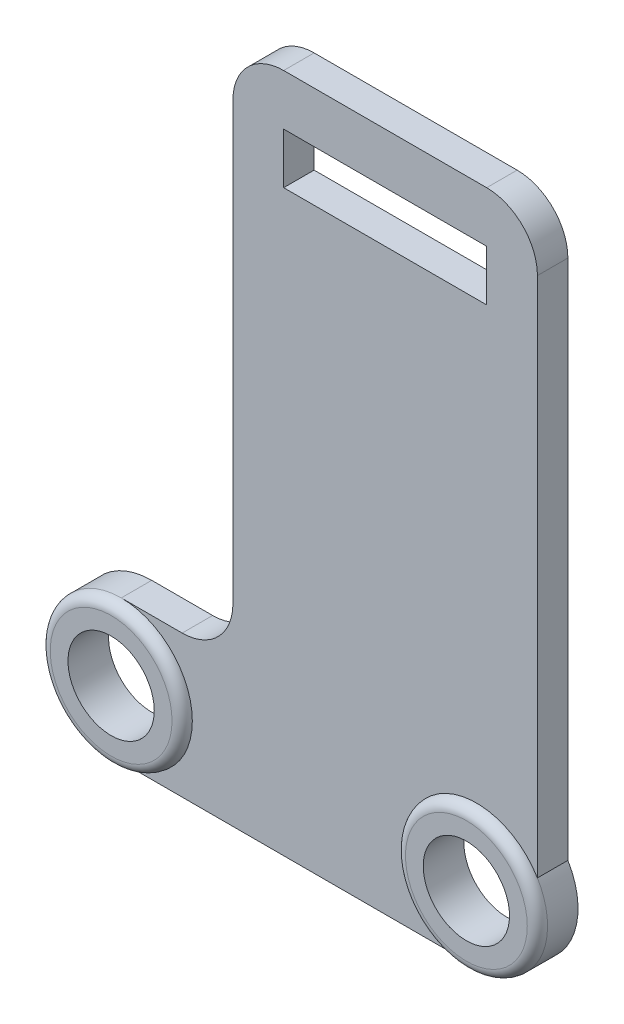
from build123d import *

# Parameters (mm, degrees)
SKETCH1_R           = 4.25
SKETCH1_W           = 20
SKETCH1_H           = 5
BOSS_EXTRUDE1_DEPTH = 3
SKETCH2_R           = 7
SKETCH2_R_2         = 4.25
BOSS_EXTRUDE2_DEPTH = 1
FILLET1_R           = 1


with BuildPart() as part:
    # Sketch1 → Boss-Extrude1 (new body)
    with BuildSketch(Plane.XY):
        with BuildLine():
            Line((9, -33.5), (-26, -33.5))
            ThreePointArc((-26, -33.5), (-33, -26.5), (-26, -19.5))
            Line((-26, -19.5), (-20, -19.5))
            ThreePointArc((-20, -19.5), (-16.464466094, -18.035533906), (-15, -14.5))
            Line((-15, -14.5), (-15, 28.5))
            ThreePointArc((-15, 28.5), (-13.535533906, 32.035533906), (-10, 33.5))
            Line((-10, 33.5), (10, 33.5))
            ThreePointArc((10, 33.5), (13.535533906, 32.035533906), (15, 28.5))
            Line((15, 28.5), (15, -22.894448725))
            ThreePointArc((15, -22.894448725), (15.092571663, -29.946820352), (9, -33.5))
        make_face()
        with Locations((9, -26.5)):
            Circle(SKETCH1_R, mode=Mode.SUBTRACT)
        with Locations((-26, -26.5)):
            Circle(SKETCH1_R, mode=Mode.SUBTRACT)
        with Locations((0, 26)):
            Rectangle(SKETCH1_W, SKETCH1_H, mode=Mode.SUBTRACT)
    extrude(amount=BOSS_EXTRUDE1_DEPTH)

    # Sketch2 → Boss-Extrude2 (add)
    # profile 1 of 2: a face of its own
    with BuildSketch(Plane.XY.offset(3)):
        with Locations(Location((-26, -26.5, 0), (0, 0, 270))):
            Circle(SKETCH2_R)
        with Locations((-26, -26.5)):
            Circle(SKETCH2_R_2, mode=Mode.SUBTRACT)
    # profile 2 of 2: a face of its own
    with BuildSketch(Plane.XY.offset(3)):
        with Locations(Location((9, -26.5, 0), (0, 0, 270))):
            Circle(SKETCH2_R)
        with Locations((9, -26.5)):
            Circle(SKETCH2_R_2, mode=Mode.SUBTRACT)
    extrude(amount=BOSS_EXTRUDE2_DEPTH)

    # Fillet1
    fillet1_edges = [part.edges().sort_by_distance(p)[0] for p in [
        (-26, -19.5, 4),
        (9, -19.5, 4),
    ]]
    fillet(fillet1_edges, radius=FILLET1_R - 0.0001)  # a hair under: the kernel refuses the full size


solid = part.part
